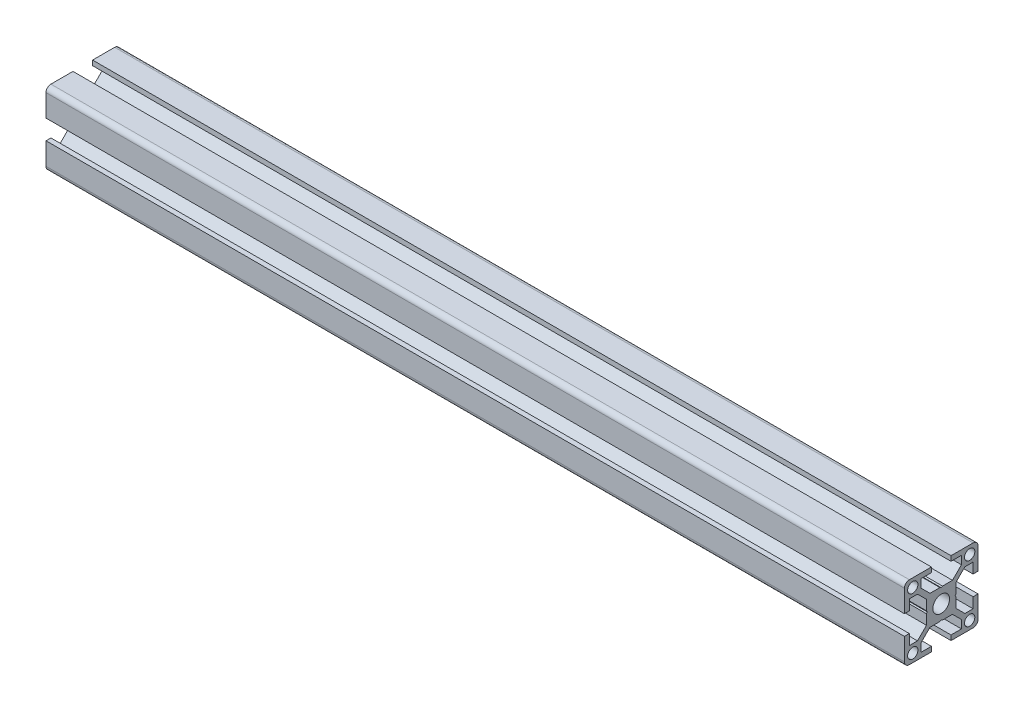
from build123d import *

# Parameters (mm, degrees)
SKETCH1_R           = 3.4
SKETCH1_R_2         = 2.1
BOSS_EXTRUDE1_DEPTH = 350


with BuildPart() as part:
    # Sketch1 → Boss-Extrude1 (new body)
    with BuildSketch(Plane(origin=(0, 0, 0), x_dir=(0, -1, 0), z_dir=(-1, 0, 0))):
        with BuildLine():
            Line((13, -4), (13, -8.25))
            Line((13, -8.25), (9.664213562, -8.25))
            Line((9.664213562, -8.25), (6, -4.585786438))
            Line((6, -4.585786438), (6, -0.519615242))
            Line((6, -0.519615242), (5.7, 0))
            Line((5.7, 0), (6, 0.519615242))
            Line((6, 0.519615242), (6, 4.585786438))
            Line((6, 4.585786438), (9.664213562, 8.25))
            Line((9.664213562, 8.25), (13, 8.25))
            Line((13, 8.25), (13, 4))
            Line((13, 4), (15, 4))
            Line((15, 4), (15, 13))
            ThreePointArc((15, 13), (14.414213562, 14.414213562), (13, 15))
            Line((13, 15), (4, 15))
            Line((4, 15), (4, 13))
            Line((4, 13), (8.25, 13))
            Line((8.25, 13), (8.25, 9.664213562))
            Line((8.25, 9.664213562), (4.585786438, 6))
            Line((4.585786438, 6), (0.519615242, 6))
            Line((0.519615242, 6), (0, 5.7))
            Line((0, 5.7), (-0.519615242, 6))
            Line((-0.519615242, 6), (-4.585786438, 6))
            Line((-4.585786438, 6), (-8.25, 9.664213562))
            Line((-8.25, 9.664213562), (-8.25, 13))
            Line((-8.25, 13), (-4, 13))
            Line((-4, 13), (-4, 15))
            Line((-4, 15), (-13, 15))
            ThreePointArc((-13, 15), (-14.414213562, 14.414213562), (-15, 13))
            Line((-15, 13), (-15, 4))
            Line((-15, 4), (-13, 4))
            Line((-13, 4), (-13, 8.25))
            Line((-13, 8.25), (-9.664213562, 8.25))
            Line((-9.664213562, 8.25), (-6, 4.585786438))
            Line((-6, 4.585786438), (-6, 0.519615242))
            Line((-6, 0.519615242), (-5.7, 0))
            Line((-5.7, 0), (-6, -0.519615242))
            Line((-6, -0.519615242), (-6, -4.585786438))
            Line((-6, -4.585786438), (-9.664213562, -8.25))
            Line((-9.664213562, -8.25), (-13, -8.25))
            Line((-13, -8.25), (-13, -4))
            Line((-13, -4), (-15, -4))
            Line((-15, -4), (-15, -13))
            ThreePointArc((-15, -13), (-14.414213562, -14.414213562), (-13, -15))
            Line((-13, -15), (-4, -15))
            Line((-4, -15), (-4, -13))
            Line((-4, -13), (-8.25, -13))
            Line((-8.25, -13), (-8.25, -9.664213562))
            Line((-8.25, -9.664213562), (-4.585786438, -6))
            Line((-4.585786438, -6), (-0.519615242, -6))
            Line((-0.519615242, -6), (0, -5.7))
            Line((0, -5.7), (0.519615242, -6))
            Line((0.519615242, -6), (4.585786438, -6))
            Line((4.585786438, -6), (8.25, -9.664213562))
            Line((8.25, -9.664213562), (8.25, -13))
            Line((8.25, -13), (4, -13))
            Line((4, -13), (4, -15))
            Line((4, -15), (13, -15))
            ThreePointArc((13, -15), (14.414213562, -14.414213562), (15, -13))
            Line((15, -13), (15, -4))
            Line((15, -4), (13, -4))
        make_face()
        Circle(SKETCH1_R, mode=Mode.SUBTRACT)
        with Locations((11.6, -11.6)):
            Circle(SKETCH1_R_2, mode=Mode.SUBTRACT)
        with Locations((11.6, 11.6)):
            Circle(SKETCH1_R_2, mode=Mode.SUBTRACT)
        with Locations((-11.6, 11.6)):
            Circle(SKETCH1_R_2, mode=Mode.SUBTRACT)
        with Locations((-11.6, -11.6)):
            Circle(SKETCH1_R_2, mode=Mode.SUBTRACT)
    extrude(amount=-BOSS_EXTRUDE1_DEPTH)


solid = part.part
